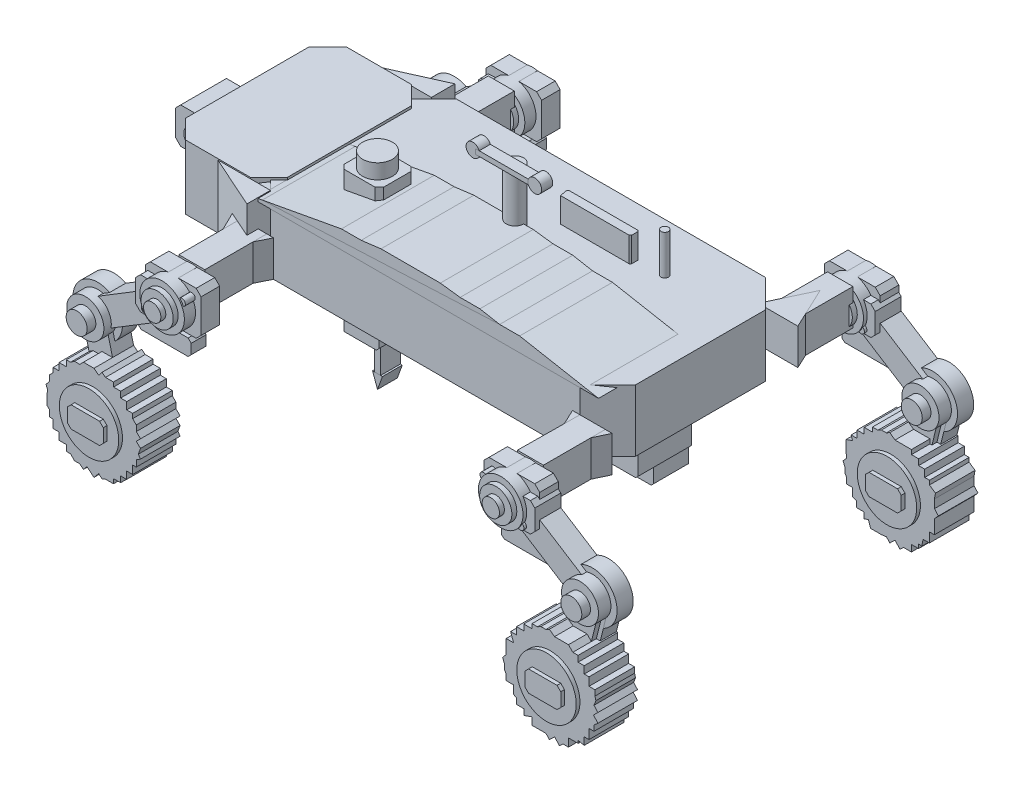
from build123d import *

# Parameters (mm, degrees)
V5_1_THICKER_CHAMFERED_MAIN_CHASSIS_DEPTH      = 100
V5_1_PROJECTING_FRONT_SENSOR_HEAD_DEPTH        = 104
V5_7_FRONT_NEAR_SHOULDER_DIAGONAL_FILL_N_DEPTH = 102
V5_7_FRONT_FAR_SHOULDER_DIAGONAL_FILL_NO_DEPTH = 102
SKETCH_5_W                                     = 42
SKETCH_5_H                                     = 100
V5_17_FRONT_NEAR_SIDE_100MM_OUTBOARD_BEA_DEPTH = 58
SKETCH_6_W                                     = 41
SKETCH_6_H                                     = 100
V5_17_REAR_NEAR_SIDE_100MM_OUTBOARD_BEAM_DEPTH = 58
SKETCH_7_W                                     = 42
SKETCH_7_H                                     = 100
V5_17_FRONT_FAR_SIDE_100MM_OUTBOARD_BEAM_DEPTH = 58
V5_17_REAR_FAR_SIDE_100MM_OUTBOARD_BEAM_DEPTH  = 58
V5_13_FRONT_NEAR_SIDE_COMPACT_ROOT_GUSSE_DEPTH = 58
V5_13_REAR_NEAR_SIDE_COMPACT_ROOT_GUSSET_DEPTH = 58
V5_13_FRONT_FAR_SIDE_COMPACT_ROOT_GUSSET_DEPTH = 58
V5_13_REAR_FAR_SIDE_COMPACT_ROOT_GUSSET_DEPTH  = 58
V5_1_NEAR_SEGMENTED_CURVED_UPPER_SHELL_DEPTH   = 150
V5_1_FAR_SEGMENTED_CURVED_UPPER_SHELL_DEPTH    = 150
V5_1_RECESSED_SIDE_PANEL_FRAME_DEPTH           = 74
V5_1_BATTERY_ELECTRONICS_PANEL_INSERT_DEPTH    = 82
V5_7_INTEGRATED_LOWER_SIDE_SKIRT_NO_LONG_DEPTH = 86
V5_7_PROTECTED_UNDERBODY_PAYLOAD_BAY_JOI_DEPTH = 60
V5_7_FRONT_SKID_VERTICAL_SUPPORT_JOINED_DEPTH  = 56
V5_7_CENTER_SKID_VERTICAL_SUPPORT_JOINED_DEPTH = 56
V5_7_REAR_SKID_VERTICAL_SUPPORT_JOINED_DEPTH   = 56
V5_1_FRONT_STEREO_CAMERA_BEZEL_DEPTH           = 74
SKETCH_23_R                                    = 15
V5_1_LEFT_RGB_CAMERA_LENS_DEPTH                = 84
SKETCH_24_R                                    = 15
V5_1_RIGHT_DEPTH_CAMERA_LENS_DEPTH             = 84
FRONT_NEAR_LEG_SIDE_HIP_MOUNT_PLATE_DEPTH      = 30
FRONT_NEAR_LEG_SIDE_FORK_CLEVIS_BLOCK_DEPTH    = 42
FRONT_NEAR_LEG_SIDE_CHAMFERED_GUSSET_BLO_DEPTH = 24
SKETCH_28_R                                    = 5.5
FRONT_NEAR_LEG_SIDE_UPPER_MOUNT_BOLT_DEPTH     = 46
SKETCH_29_R                                    = 5.5
FRONT_NEAR_LEG_SIDE_LOWER_MOUNT_BOLT_DEPTH     = 46
FRONT_NEAR_LEG_SIDE_UPPER_PARALLEL_LINK_DEPTH  = 34
FRONT_NEAR_LEG_SIDE_INNER_UPPER_LINK_DEPTH     = 26
FRONT_NEAR_LEG_SIDE_LOWER_PARALLEL_LINK_DEPTH  = 34
FRONT_NEAR_LEG_SIDE_INNER_LOWER_LINK_DEPTH     = 26
SKETCH_34_R                                    = 36
FRONT_NEAR_LEG_SIDE_HIP_JOINT_POD_DEPTH        = 48
SKETCH_35_R                                    = 26
FRONT_NEAR_LEG_SIDE_HIP_ANGLE_CONTROL_WA_DEPTH = 56
SKETCH_36_R                                    = 14
FRONT_NEAR_LEG_SIDE_HIP_PIN_CAP_DEPTH          = 64
SKETCH_37_R                                    = 30
FRONT_NEAR_LEG_SIDE_KNEE_JOINT_POD_DEPTH       = 46
SKETCH_38_R                                    = 40
FRONT_NEAR_LEG_SIDE_KNEE_OUTER_ANGLE_PLA_DEPTH = 26
SKETCH_39_R                                    = 17
FRONT_NEAR_LEG_SIDE_KNEE_PIN_CAP_DEPTH         = 60
SKETCH_40_R                                    = 30
FRONT_NEAR_LEG_SIDE_AXLE_JOINT_POD_DEPTH       = 46
SKETCH_41_R                                    = 21
FRONT_NEAR_LEG_SIDE_AXLE_PIN_CAP_DEPTH         = 58
FRONT_NEAR_LEG_SIDE_MOUNTED_BLOCK_TREAD_DEPTH  = 64
SKETCH_43_R                                    = 48
FRONT_NEAR_LEG_SIDE_SILVER_HUB_DISC_DEPTH      = 70
FRONT_NEAR_LEG_SIDE_RECTANGULAR_HUB_CAP_DEPTH  = 76
REAR_NEAR_LEG_SIDE_HIP_MOUNT_PLATE_DEPTH       = 30
REAR_NEAR_LEG_SIDE_FORK_CLEVIS_BLOCK_DEPTH     = 42
REAR_NEAR_LEG_SIDE_CHAMFERED_GUSSET_BLOC_DEPTH = 24
SKETCH_48_R                                    = 5.5
REAR_NEAR_LEG_SIDE_UPPER_MOUNT_BOLT_DEPTH      = 46
SKETCH_49_R                                    = 5.5
REAR_NEAR_LEG_SIDE_LOWER_MOUNT_BOLT_DEPTH      = 46
REAR_NEAR_LEG_SIDE_UPPER_PARALLEL_LINK_DEPTH   = 34
REAR_NEAR_LEG_SIDE_INNER_UPPER_LINK_DEPTH      = 26
REAR_NEAR_LEG_SIDE_LOWER_PARALLEL_LINK_DEPTH   = 34
REAR_NEAR_LEG_SIDE_INNER_LOWER_LINK_DEPTH      = 26
SKETCH_54_R                                    = 36
REAR_NEAR_LEG_SIDE_HIP_JOINT_POD_DEPTH         = 48
SKETCH_55_R                                    = 26
REAR_NEAR_LEG_SIDE_HIP_ANGLE_CONTROL_WAS_DEPTH = 56
SKETCH_56_R                                    = 14
REAR_NEAR_LEG_SIDE_HIP_PIN_CAP_DEPTH           = 64
SKETCH_57_R                                    = 29.877507243
REAR_NEAR_LEG_SIDE_KNEE_JOINT_POD_DEPTH        = 46
SKETCH_58_R                                    = 40
REAR_NEAR_LEG_SIDE_KNEE_OUTER_ANGLE_PLAT_DEPTH = 26
SKETCH_59_R                                    = 17
REAR_NEAR_LEG_SIDE_KNEE_PIN_CAP_DEPTH          = 60
SKETCH_60_R                                    = 30.007079554
REAR_NEAR_LEG_SIDE_AXLE_JOINT_POD_DEPTH        = 46
SKETCH_61_R                                    = 21
REAR_NEAR_LEG_SIDE_AXLE_PIN_CAP_DEPTH          = 58
REAR_NEAR_LEG_SIDE_MOUNTED_BLOCK_TREAD_T_DEPTH = 64
SKETCH_63_R                                    = 48
REAR_NEAR_LEG_SIDE_SILVER_HUB_DISC_DEPTH       = 70
REAR_NEAR_LEG_SIDE_RECTANGULAR_HUB_CAP_DEPTH   = 76
FRONT_FAR_LEG_SIDE_HIP_MOUNT_PLATE_DEPTH       = 30
FRONT_FAR_LEG_SIDE_FORK_CLEVIS_BLOCK_DEPTH     = 42
FRONT_FAR_LEG_SIDE_CHAMFERED_GUSSET_BLOC_DEPTH = 24
SKETCH_68_R                                    = 5.555512755
FRONT_FAR_LEG_SIDE_UPPER_MOUNT_BOLT_DEPTH      = 46
SKETCH_69_R                                    = 5.5
FRONT_FAR_LEG_SIDE_LOWER_MOUNT_BOLT_DEPTH      = 46
FRONT_FAR_LEG_SIDE_UPPER_PARALLEL_LINK_DEPTH   = 34
FRONT_FAR_LEG_SIDE_INNER_UPPER_LINK_DEPTH      = 26
FRONT_FAR_LEG_SIDE_LOWER_PARALLEL_LINK_DEPTH   = 34
FRONT_FAR_LEG_SIDE_INNER_LOWER_LINK_DEPTH      = 26
SKETCH_74_R                                    = 36
FRONT_FAR_LEG_SIDE_HIP_JOINT_POD_DEPTH         = 48
SKETCH_75_R                                    = 26
FRONT_FAR_LEG_SIDE_HIP_ANGLE_CONTROL_WAS_DEPTH = 56
SKETCH_76_R                                    = 14
FRONT_FAR_LEG_SIDE_HIP_PIN_CAP_DEPTH           = 64
SKETCH_77_R                                    = 30
FRONT_FAR_LEG_SIDE_KNEE_JOINT_POD_DEPTH        = 46
SKETCH_78_R                                    = 40
FRONT_FAR_LEG_SIDE_KNEE_OUTER_ANGLE_PLAT_DEPTH = 26
SKETCH_79_R                                    = 17
FRONT_FAR_LEG_SIDE_KNEE_PIN_CAP_DEPTH          = 60
SKETCH_80_R                                    = 30
FRONT_FAR_LEG_SIDE_AXLE_JOINT_POD_DEPTH        = 46
SKETCH_81_R                                    = 21
FRONT_FAR_LEG_SIDE_AXLE_PIN_CAP_DEPTH          = 58
FRONT_FAR_LEG_SIDE_MOUNTED_BLOCK_TREAD_T_DEPTH = 64
SKETCH_83_R                                    = 48
FRONT_FAR_LEG_SIDE_SILVER_HUB_DISC_DEPTH       = 70
FRONT_FAR_LEG_SIDE_RECTANGULAR_HUB_CAP_DEPTH   = 76
REAR_FAR_LEG_SIDE_HIP_MOUNT_PLATE_DEPTH        = 30
REAR_FAR_LEG_SIDE_FORK_CLEVIS_BLOCK_DEPTH      = 42
REAR_FAR_LEG_SIDE_CHAMFERED_GUSSET_BLOCK_DEPTH = 24
SKETCH_88_R                                    = 5.5
REAR_FAR_LEG_SIDE_UPPER_MOUNT_BOLT_DEPTH       = 46
SKETCH_89_R                                    = 5.566740906
REAR_FAR_LEG_SIDE_LOWER_MOUNT_BOLT_DEPTH       = 46
REAR_FAR_LEG_SIDE_UPPER_PARALLEL_LINK_DEPTH    = 34
REAR_FAR_LEG_SIDE_INNER_UPPER_LINK_DEPTH       = 26
REAR_FAR_LEG_SIDE_LOWER_PARALLEL_LINK_DEPTH    = 34
REAR_FAR_LEG_SIDE_INNER_LOWER_LINK_DEPTH       = 26
SKETCH_94_R                                    = 36
REAR_FAR_LEG_SIDE_HIP_JOINT_POD_DEPTH          = 48
SKETCH_95_R                                    = 26
REAR_FAR_LEG_SIDE_HIP_ANGLE_CONTROL_WASH_DEPTH = 56
SKETCH_96_R                                    = 14
REAR_FAR_LEG_SIDE_HIP_PIN_CAP_DEPTH            = 64
SKETCH_97_R                                    = 30
REAR_FAR_LEG_SIDE_KNEE_JOINT_POD_DEPTH         = 46
SKETCH_98_R                                    = 40
REAR_FAR_LEG_SIDE_KNEE_OUTER_ANGLE_PLATE_DEPTH = 26
SKETCH_99_R                                    = 17
REAR_FAR_LEG_SIDE_KNEE_PIN_CAP_DEPTH           = 60
SKETCH_100_R                                   = 30
REAR_FAR_LEG_SIDE_AXLE_JOINT_POD_DEPTH         = 46
SKETCH_101_R                                   = 21
REAR_FAR_LEG_SIDE_AXLE_PIN_CAP_DEPTH           = 58
REAR_FAR_LEG_SIDE_MOUNTED_BLOCK_TREAD_TI_DEPTH = 64
SKETCH_103_R                                   = 48
REAR_FAR_LEG_SIDE_SILVER_HUB_DISC_DEPTH        = 70
REAR_FAR_LEG_SIDE_RECTANGULAR_HUB_CAP_DEPTH    = 76
V5_1_ROOF_LIDAR_RTK_BASE_DEPTH                 = 142
SKETCH_106_R                                   = 24
V5_1_LIDAR_RTK_CYLINDRICAL_PUCK_DEPTH          = 166
SKETCH_107_R                                   = 14
V5_1_TALL_ENVIRONMENT_WEATHER_MAST_DEPTH       = 208
SKETCH_108_W                                   = 92
SKETCH_108_H                                   = 8
V5_1_ANEMOMETER_CROSSBAR_DEPTH                 = 18
SKETCH_109_R                                   = 11
V5_1_LEFT_WIND_CUP_DEPTH                       = 18
SKETCH_110_R                                   = 11
V5_1_RIGHT_WIND_CUP_DEPTH                      = 18
SKETCH_111_R                                   = 6
V5_1_SHORT_TELEMETRY_ANTENNA_DEPTH             = 164
V5_1_SILVER_TOP_SERVICE_HANDLE_BAR_DEPTH       = 140
V5_7_SOIL_PROBE_MOUNTING_COLLAR_JOINED_T_DEPTH = 60
SKETCH_114_W                                   = 10
SKETCH_114_H                                   = 92
V5_1_DOWNWARD_SOIL_MOISTURE_PROBE_ROD_DEPTH    = 32
V5_1_SOIL_PROBE_TAPERED_TIP_DEPTH              = 32


with BuildPart() as part:
    # 草图1 → v5_1_thicker_chamfered_main_chassis (new body)
    with BuildSketch(Plane(origin=(0, 0, 0), x_dir=(1, 0, 0), z_dir=(0, 1, 0))):
        Polygon((-225, -150), (275, -150), (320, -105), (320, 105), (275, 150), (-225, 150), (-270, 105), (-270, -105), align=None)
    extrude(amount=V5_1_THICKER_CHAMFERED_MAIN_CHASSIS_DEPTH)

    # 草图17 → v5_7_integrated_lower_side_skirt_no_long_gap (add)
    with BuildSketch(Plane.XY):
        Polygon((-191, -49), (301, -49), (305, -45), (305, 9), (301, 13), (-191, 13), (-195, 9), (-195, -45), align=None)
    extrude(amount=V5_7_INTEGRATED_LOWER_SIDE_SKIRT_NO_LONG_DEPTH)

    # 草图18 → v5_7_protected_underbody_payload_bay_joined (add)
    with BuildSketch(Plane.XY):
        Polygon((-135, -76), (15, -76), (20, -71), (20, -37), (15, -32), (-135, -32), (-140, -37), (-140, -71), align=None)
    extrude(amount=V5_7_PROTECTED_UNDERBODY_PAYLOAD_BAY_JOI_DEPTH)

    # 草图19 → v5_7_front_skid_vertical_support_joined (add)
    with BuildSketch(Plane.XY):
        Polygon((-181, -77), (-159, -77), (-155, -73), (-155, -15), (-159, -11), (-181, -11), (-185, -15), (-185, -73), align=None)
    extrude(amount=V5_7_FRONT_SKID_VERTICAL_SUPPORT_JOINED_DEPTH)

    # 草图20 → v5_7_center_skid_vertical_support_joined (add)
    with BuildSketch(Plane.XY):
        Polygon((29, -77), (51, -77), (55, -73), (55, -15), (51, -11), (29, -11), (25, -15), (25, -73), align=None)
    extrude(amount=V5_7_CENTER_SKID_VERTICAL_SUPPORT_JOINED_DEPTH)

    # 草图21 → v5_7_rear_skid_vertical_support_joined (add)
    with BuildSketch(Plane.XY):
        Polygon((274, -77), (296, -77), (300, -73), (300, -15), (296, -11), (274, -11), (270, -15), (270, -73), align=None)
    extrude(amount=V5_7_REAR_SKID_VERTICAL_SUPPORT_JOINED_DEPTH)

    # 草图113 → v5_7_soil_probe_mounting_collar_joined_to_underbody (add)
    with BuildSketch(Plane.XY):
        Polygon((-196, -106), (-144, -106), (-140, -102), (-140, -46), (-144, -42), (-195, -42), (-196, -42), align=None)
    extrude(amount=V5_7_SOIL_PROBE_MOUNTING_COLLAR_JOINED_T_DEPTH)


with BuildPart() as body_2:
    # 草图2 → v5_1_projecting_front_sensor_head (new body)
    with BuildSketch(Plane(origin=(0, 0, 0), x_dir=(1, 0, 0), z_dir=(0, 1, 0))):
        Polygon((-382.5, -130), (-277.5, -130), (-247.5, -100), (-247.5, 100), (-277.5, 130), (-382.5, 130), (-412.5, 100), (-412.5, -100), align=None)
    extrude(amount=V5_1_PROJECTING_FRONT_SENSOR_HEAD_DEPTH)


with BuildPart() as body_3:
    # 草图3 → v5_7_front_near_shoulder_diagonal_fill_no_gap (new body)
    with BuildSketch(Plane(origin=(0, 0, 0), x_dir=(1, 0, 0), z_dir=(0, 1, 0))):
        Polygon((-330, 130), (-245, 130), (-245, 168), align=None)
    extrude(amount=V5_7_FRONT_NEAR_SHOULDER_DIAGONAL_FILL_N_DEPTH)


with BuildPart() as body_4:
    # 草图4 → v5_7_front_far_shoulder_diagonal_fill_no_gap (new body)
    with BuildSketch(Plane(origin=(0, 0, 0), x_dir=(1, 0, 0), z_dir=(0, 1, 0))):
        Polygon((-330, -130), (-245, -130), (-245, -168), align=None)
    extrude(amount=V5_7_FRONT_FAR_SHOULDER_DIAGONAL_FILL_NO_DEPTH)


with BuildPart() as body_5:
    # 草图5 → v5_17_front_near_side_100mm_outboard_beam_connected (new body)
    with BuildSketch(Plane(origin=(0, 0, 0), x_dir=(1, 0, 0), z_dir=(0, 1, 0))):
        with Locations((-252, 200)):
            Rectangle(SKETCH_5_W, SKETCH_5_H)
    extrude(amount=V5_17_FRONT_NEAR_SIDE_100MM_OUTBOARD_BEA_DEPTH)


with BuildPart() as body_6:
    # 草图6 → v5_17_rear_near_side_100mm_outboard_beam_connected (new body)
    with BuildSketch(Plane(origin=(0, 0, 0), x_dir=(1, 0, 0), z_dir=(0, 1, 0))):
        with Locations((295.5, 200)):
            Rectangle(SKETCH_6_W, SKETCH_6_H)
    extrude(amount=V5_17_REAR_NEAR_SIDE_100MM_OUTBOARD_BEAM_DEPTH)


with BuildPart() as body_7:
    # 草图7 → v5_17_front_far_side_100mm_outboard_beam_connected (new body)
    with BuildSketch(Plane(origin=(0, 0, 0), x_dir=(1, 0, 0), z_dir=(0, 1, 0))):
        with Locations((-252, -200)):
            Rectangle(SKETCH_7_W, SKETCH_7_H)
    extrude(amount=V5_17_FRONT_FAR_SIDE_100MM_OUTBOARD_BEAM_DEPTH)


with BuildPart() as body_8:
    # 草图8 → v5_17_rear_far_side_100mm_outboard_beam_connected (new body)
    with BuildSketch(Plane(origin=(0, 0, 0), x_dir=(1, 0, 0), z_dir=(0, 1, 0))):
        Polygon((274, -250), (316, -250), (316, -150), (275, -150), align=None)
    extrude(amount=V5_17_REAR_FAR_SIDE_100MM_OUTBOARD_BEAM_DEPTH)


with BuildPart() as body_9:
    # 草图9 → v5_13_front_near_side_compact_root_gusset (new body)
    with BuildSketch(Plane(origin=(0, 0, 0), x_dir=(1, 0, 0), z_dir=(0, 1, 0))):
        Polygon((-287.5, 149), (-220, 150), (-253.75, 218), align=None)
    extrude(amount=V5_13_FRONT_NEAR_SIDE_COMPACT_ROOT_GUSSE_DEPTH)


with BuildPart() as body_10:
    # 草图10 → v5_13_rear_near_side_compact_root_gusset (new body)
    with BuildSketch(Plane(origin=(0, 0, 0), x_dir=(1, 0, 0), z_dir=(0, 1, 0))):
        Polygon((263, 150), (327, 150), (295, 218), align=None)
    extrude(amount=V5_13_REAR_NEAR_SIDE_COMPACT_ROOT_GUSSET_DEPTH)


with BuildPart() as body_11:
    # 草图11 → v5_13_front_far_side_compact_root_gusset (new body)
    with BuildSketch(Plane(origin=(0, 0, 0), x_dir=(1, 0, 0), z_dir=(0, 1, 0))):
        Polygon((-287.5, -149), (-220, -150), (-253.75, -218), align=None)
    extrude(amount=V5_13_FRONT_FAR_SIDE_COMPACT_ROOT_GUSSET_DEPTH)


with BuildPart() as body_12:
    # 草图12 → v5_13_rear_far_side_compact_root_gusset (new body)
    with BuildSketch(Plane(origin=(0, 0, 0), x_dir=(1, 0, 0), z_dir=(0, 1, 0))):
        Polygon((263, -150), (327, -150), (295, -218), align=None)
    extrude(amount=V5_13_REAR_FAR_SIDE_COMPACT_ROOT_GUSSET_DEPTH)


with BuildPart() as body_13:
    # 草图13 → v5_1_near_segmented_curved_upper_shell (new body)
    with BuildSketch(Plane.XY):
        Polygon((-270, 96), (305, 96), (273.055555556, 101.904038041), (241.14317141, 107.802150631), (209.293933726, 113.688592362), (177.537009993, 119.557972438), (145.277777778, 119.557972438), (113.333333333, 125.444863729), (81.388888889, 125.444863729), (49.444444444, 129.483463602), (17.5, 129.483463602), (-14.444444444, 129.483463602), (-46.388888889, 129.483463602), (-78.333333333, 125.444863729), (-110.277777778, 125.444863729), (-142.222222222, 119.557972438), (-174.071644358, 113.688592362), (-206.013649328, 107.802150631), (-238.018984687, 101.904038041), align=None)
    extrude(amount=V5_1_NEAR_SEGMENTED_CURVED_UPPER_SHELL_DEPTH)


with BuildPart() as body_14:
    # 草图14 → v5_1_far_segmented_curved_upper_shell (new body)
    with BuildSketch(Plane.XY):
        Polygon((-270, 96), (305, 96), (273.055555556, 101.904038041), (241.268504996, 107.778986219), (209.293933726, 113.688592362), (177.537009993, 119.557972438), (145.277777778, 119.557972438), (113.333333333, 125.444863729), (81.388888889, 125.444863729), (49.444444444, 129.483463602), (17.5, 129.483463602), (-14.444444444, 129.483463602), (-46.388888889, 129.483463602), (-78.333333333, 125.444863729), (-110.277777778, 125.444863729), (-142.222222222, 119.557972438), (-174.148381232, 113.674450885), (-206.139347974, 107.778986219), (-238.018984687, 101.904038041), align=None)
    extrude(amount=V5_1_FAR_SEGMENTED_CURVED_UPPER_SHELL_DEPTH)


with BuildPart() as body_15:
    # 草图15 → v5_1_recessed_side_panel_frame (new body)
    with BuildSketch(Plane.XY):
        Polygon((10.5, 14), (199.5, 14), (207.5, 22), (207.5, 82), (199.5, 90), (10.5, 90), (0, 79.5), (0, 22), align=None)
    extrude(amount=V5_1_RECESSED_SIDE_PANEL_FRAME_DEPTH)


with BuildPart() as body_16:
    # 草图16 → v5_1_battery_electronics_panel_insert (new body)
    with BuildSketch(Plane.XY):
        Polygon((31, 28), (179, 28), (184, 33), (184, 75), (179, 80), (31, 80), (26, 75), (26, 33), align=None)
    extrude(amount=V5_1_BATTERY_ELECTRONICS_PANEL_INSERT_DEPTH)


with BuildPart() as body_17:
    # 草图22 → v5_1_front_stereo_camera_bezel (new body)
    with BuildSketch(Plane.XY):
        Polygon((-446, 35), (-338, 35), (-330, 43), (-330, 85), (-338, 93), (-446, 93), (-454, 85), (-454, 43), align=None)
    extrude(amount=V5_1_FRONT_STEREO_CAMERA_BEZEL_DEPTH)


with BuildPart() as body_18:
    # 草图23 → v5_1_left_rgb_camera_lens (new body)
    with BuildSketch(Plane.XY):
        with Locations(Location((-416, 66, 0), (0, 0, 180))):
            Circle(SKETCH_23_R)
    extrude(amount=V5_1_LEFT_RGB_CAMERA_LENS_DEPTH)


with BuildPart() as body_19:
    # 草图24 → v5_1_right_depth_camera_lens (new body)
    with BuildSketch(Plane.XY):
        with Locations(Location((-370, 66, 0), (0, 0, 180))):
            Circle(SKETCH_24_R)
    extrude(amount=V5_1_RIGHT_DEPTH_CAMERA_LENS_DEPTH)


with BuildPart() as body_20:
    # 草图25 → front_near_leg_side_hip_mount_plate (new body)
    with BuildSketch(Plane.XY.offset(250)):
        Polygon((-289, -15), (-215, -15), (-207, -7), (-207, 47), (-215, 55), (-289, 55), (-297, 47), (-297, -7), align=None)
    extrude(amount=FRONT_NEAR_LEG_SIDE_HIP_MOUNT_PLATE_DEPTH)


with BuildPart() as body_21:
    # 草图26 → front_near_leg_side_fork_clevis_block (new body)
    with BuildSketch(Plane.XY.offset(250)):
        Polygon((-293, -11), (-246, -11), (-238, -3), (-238, 33), (-246, 41), (-293, 41), (-301, 33), (-301, -3), align=None)
    extrude(amount=FRONT_NEAR_LEG_SIDE_FORK_CLEVIS_BLOCK_DEPTH)


with BuildPart() as body_22:
    # 草图27 → front_near_leg_side_chamfered_gusset_block (new body)
    with BuildSketch(Plane.XY.offset(250)):
        Polygon((-310, -53), (-234, -53), (-229, -48), (-229, -32), (-234, -27), (-310, -27), (-315, -32), (-315, -48), align=None)
    extrude(amount=FRONT_NEAR_LEG_SIDE_CHAMFERED_GUSSET_BLO_DEPTH)


with BuildPart() as body_23:
    # 草图28 → front_near_leg_side_upper_mount_bolt (new body)
    with BuildSketch(Plane.XY.offset(250)):
        with Locations((-222, 40)):
            Circle(SKETCH_28_R)
    extrude(amount=FRONT_NEAR_LEG_SIDE_UPPER_MOUNT_BOLT_DEPTH)


with BuildPart() as body_24:
    # 草图29 → front_near_leg_side_lower_mount_bolt (new body)
    with BuildSketch(Plane.XY.offset(250)):
        with Locations((-282, 0)):
            Circle(SKETCH_29_R)
    extrude(amount=FRONT_NEAR_LEG_SIDE_LOWER_MOUNT_BOLT_DEPTH)


with BuildPart() as body_25:
    # 草图30 → front_near_leg_side_upper_parallel_link (new body)
    with BuildSketch(Plane.XY.offset(250)):
        Polygon((-241.279837267, 0), (-367.279837267, -76.884256305), (-388.111687363, -42.744456581), (-261.334784086, 34.613860284), align=None)
    extrude(amount=FRONT_NEAR_LEG_SIDE_UPPER_PARALLEL_LINK_DEPTH)


with BuildPart() as body_26:
    # 草图31 → front_near_leg_side_inner_upper_link (new body)
    with BuildSketch(Plane.XY.offset(250)):
        Polygon((-262.17592677, 0), (-388.17592677, -77.597915337), (-397.614039026, -62.272733739), (-270.751527953, 15.856364623), align=None)
    extrude(amount=FRONT_NEAR_LEG_SIDE_INNER_UPPER_LINK_DEPTH)


with BuildPart() as body_27:
    # 草图32 → front_near_leg_side_lower_parallel_link (new body)
    with BuildSketch(Plane.XY.offset(250)):
        Polygon((-358.597149997, -55.149287499), (-328.597149997, -175.149287499), (-367.402850003, -184.850712501), (-396.404882451, -64.236107726), align=None)
    extrude(amount=FRONT_NEAR_LEG_SIDE_LOWER_PARALLEL_LINK_DEPTH)


with BuildPart() as body_28:
    # 草图33 → front_near_leg_side_inner_lower_link (new body)
    with BuildSketch(Plane.XY.offset(250)):
        Polygon((-384.268717499, -67.817179375), (-354.268717499, -187.817179375), (-369.268717499, -191.567179375), (-399.268717499, -71.567179375), align=None)
    extrude(amount=FRONT_NEAR_LEG_SIDE_INNER_LOWER_LINK_DEPTH)


with BuildPart() as body_29:
    # 草图34 → front_near_leg_side_hip_joint_pod (new body)
    with BuildSketch(Plane.XY.offset(250)):
        with Locations((-252, 20)):
            Circle(SKETCH_34_R)
    extrude(amount=FRONT_NEAR_LEG_SIDE_HIP_JOINT_POD_DEPTH)


with BuildPart() as body_30:
    # 草图35 → front_near_leg_side_hip_angle_control_washer (new body)
    with BuildSketch(Plane.XY.offset(250)):
        with Locations((-252, 20)):
            Circle(SKETCH_35_R)
    extrude(amount=FRONT_NEAR_LEG_SIDE_HIP_ANGLE_CONTROL_WA_DEPTH)


with BuildPart() as body_31:
    # 草图36 → front_near_leg_side_hip_pin_cap (new body)
    with BuildSketch(Plane.XY.offset(250)):
        with Locations((-252, 20)):
            Circle(SKETCH_36_R)
    extrude(amount=FRONT_NEAR_LEG_SIDE_HIP_PIN_CAP_DEPTH)


with BuildPart() as body_32:
    # 草图37 → front_near_leg_side_knee_joint_pod (new body)
    with BuildSketch(Plane.XY.offset(250)):
        with Locations((-378, -60)):
            Circle(SKETCH_37_R)
    extrude(amount=FRONT_NEAR_LEG_SIDE_KNEE_JOINT_POD_DEPTH)


with BuildPart() as body_33:
    # 草图38 → front_near_leg_side_knee_outer_angle_plate (new body)
    with BuildSketch(Plane.XY.offset(250)):
        with Locations(Location((-378, -60, 0), (0, 0, 180))):
            Circle(SKETCH_38_R)
    extrude(amount=FRONT_NEAR_LEG_SIDE_KNEE_OUTER_ANGLE_PLA_DEPTH)


with BuildPart() as body_34:
    # 草图39 → front_near_leg_side_knee_pin_cap (new body)
    with BuildSketch(Plane.XY.offset(250)):
        with Locations((-378, -60)):
            Circle(SKETCH_39_R)
    extrude(amount=FRONT_NEAR_LEG_SIDE_KNEE_PIN_CAP_DEPTH)


with BuildPart() as body_35:
    # 草图40 → front_near_leg_side_axle_joint_pod (new body)
    with BuildSketch(Plane.XY.offset(250)):
        with Locations((-348, -180)):
            Circle(SKETCH_40_R)
    extrude(amount=FRONT_NEAR_LEG_SIDE_AXLE_JOINT_POD_DEPTH)


with BuildPart() as body_36:
    # 草图41 → front_near_leg_side_axle_pin_cap (new body)
    with BuildSketch(Plane.XY.offset(250)):
        with Locations(Location((-348, -180, 0), (0, 0, 180))):
            Circle(SKETCH_41_R)
    extrude(amount=FRONT_NEAR_LEG_SIDE_AXLE_PIN_CAP_DEPTH)


with BuildPart() as body_37:
    # 草图42 → front_near_leg_side_mounted_block_tread_tire (new body)
    with BuildSketch(Plane.XY.offset(250)):
        Polygon((-271, -180), (-277.650550685, -173.349449315), (-270.879339992, -166.578238622), (-277.650550685, -159.807027929), (-277.650550685, -150.533375708), (-283.518342469, -144.665583923), (-283.518342469, -137.221092057), (-293.116257811, -137.221092057), (-293.116257811, -125.552777849), (-302.958076824, -125.552777849), (-302.958076824, -115.976839853), (-314.530831685, -115.976839853), (-314.530831685, -108.861275997), (-327.389787915, -108.861275997), (-332.978045205, -104.479533409), (-338.408784826, -111.405629515), (-346.026280737, -105.432764539), (-354.959216963, -105.432764539), (-363.021954795, -105.432764539), (-368.994819772, -111.405629515), (-377.466624292, -111.405629515), (-383.963715854, -115.976839853), (-390.778907943, -115.976839853), (-390.778907943, -125.552777849), (-402.447222151, -125.552777849), (-402.447222151, -137.221092057), (-412.023160147, -137.221092057), (-412.023160147, -144.665583923), (-417.890951932, -150.533375708), (-417.890951932, -159.807027929), (-423.520466591, -166.578238622), (-420.705709261, -173.349449315), (-422.113087926, -180), (-422.113087926, -186.959216963), (-422.113087926, -195.021954795), (-417.890951932, -199.24409079), (-417.890951932, -209.466624292), (-412.023160147, -209.466624292), (-412.023160147, -222.778907943), (-402.447222151, -222.778907943), (-402.447222151, -234.447222151), (-390.778907943, -234.447222151), (-390.778907943, -244.023160147), (-383.963715854, -244.023160147), (-377.466624292, -250.520251709), (-368.994819772, -250.520251709), (-363.021954795, -255.520466591), (-357.306422913, -248.693139964), (-346.026280737, -258.136369469), (-338.408784826, -249.037105615), (-332.978045205, -253.583477445), (-327.389787915, -251.31029153), (-314.530831685, -251.31029153), (-314.530831685, -244.023160147), (-302.958076824, -244.023160147), (-302.958076824, -234.447222151), (-293.116257811, -234.447222151), (-293.116257811, -222.778907943), (-283.518342469, -222.778907943), (-283.518342469, -209.466624292), (-277.650550685, -209.466624292), (-277.650550685, -199.24409079), (-271, -195.021954795), (-274.325275342, -189.784105461), align=None)
    extrude(amount=FRONT_NEAR_LEG_SIDE_MOUNTED_BLOCK_TREAD_DEPTH)


with BuildPart() as body_38:
    # 草图43 → front_near_leg_side_silver_hub_disc (new body)
    with BuildSketch(Plane.XY.offset(250)):
        with Locations((-348, -180)):
            Circle(SKETCH_43_R)
    extrude(amount=FRONT_NEAR_LEG_SIDE_SILVER_HUB_DISC_DEPTH)


with BuildPart() as body_39:
    # 草图44 → front_near_leg_side_rectangular_hub_cap (new body)
    with BuildSketch(Plane.XY.offset(250)):
        Polygon((-371, -197), (-325, -197), (-319, -191), (-319, -169), (-325, -163), (-371, -163), (-377, -169), (-377, -191), align=None)
    extrude(amount=FRONT_NEAR_LEG_SIDE_RECTANGULAR_HUB_CAP_DEPTH)


with BuildPart() as body_40:
    # 草图45 → rear_near_leg_side_hip_mount_plate (new body)
    with BuildSketch(Plane.XY.offset(250)):
        Polygon((258, -15), (332, -15), (340, -7), (340, 47), (332, 55), (258, 55), (250, 47), (250, -7), align=None)
    extrude(amount=REAR_NEAR_LEG_SIDE_HIP_MOUNT_PLATE_DEPTH)


with BuildPart() as body_41:
    # 草图46 → rear_near_leg_side_fork_clevis_block (new body)
    with BuildSketch(Plane.XY.offset(250)):
        Polygon((289, -7), (337, -7), (344, 0), (344, 33), (337, 40), (289, 40), (282, 33), (282, 0), align=None)
    extrude(amount=REAR_NEAR_LEG_SIDE_FORK_CLEVIS_BLOCK_DEPTH)


with BuildPart() as body_42:
    # 草图47 → rear_near_leg_side_chamfered_gusset_block (new body)
    with BuildSketch(Plane.XY.offset(250)):
        Polygon((277, -53), (353, -53), (358, -48), (358, -32), (353, -27), (277, -27), (272, -32), (272, -49), align=None)
    extrude(amount=REAR_NEAR_LEG_SIDE_CHAMFERED_GUSSET_BLOC_DEPTH)


with BuildPart() as body_43:
    # 草图48 → rear_near_leg_side_upper_mount_bolt (new body)
    with BuildSketch(Plane.XY.offset(250)):
        with Locations((265, 40)):
            Circle(SKETCH_48_R)
    extrude(amount=REAR_NEAR_LEG_SIDE_UPPER_MOUNT_BOLT_DEPTH)


with BuildPart() as body_44:
    # 草图49 → rear_near_leg_side_lower_mount_bolt (new body)
    with BuildSketch(Plane.XY.offset(250)):
        with Locations((325, 0)):
            Circle(SKETCH_49_R)
    extrude(amount=REAR_NEAR_LEG_SIDE_LOWER_MOUNT_BOLT_DEPTH)


with BuildPart() as body_45:
    # 草图50 → rear_near_leg_side_upper_parallel_link (new body)
    with BuildSketch(Plane.XY.offset(250)):
        Polygon((305.720162733, 36.884256305), (431.720162733, -43.115743695), (410.279837267, -76.884256305), (282, 4.56325942), align=None)
    extrude(amount=REAR_NEAR_LEG_SIDE_UPPER_PARALLEL_LINK_DEPTH)


with BuildPart() as body_46:
    # 草图51 → rear_near_leg_side_inner_upper_link (new body)
    with BuildSketch(Plane.XY.offset(250)):
        Polygon((314.82407323, 17.597915337), (440.82407323, -62.402084663), (431.17592677, -77.597915337), (308.959210114, 0), align=None)
    extrude(amount=REAR_NEAR_LEG_SIDE_INNER_UPPER_LINK_DEPTH)


with BuildPart() as body_47:
    # 草图52 → rear_near_leg_side_lower_parallel_link (new body)
    with BuildSketch(Plane.XY.offset(250)):
        Polygon((440.82407323, -62.402084663), (410.402850003, -184.850712501), (371.58299089, -175.206279398), (401.420912284, -55.105502878), align=None)
    extrude(amount=REAR_NEAR_LEG_SIDE_LOWER_PARALLEL_LINK_DEPTH)


with BuildPart() as body_48:
    # 草图53 → rear_near_leg_side_inner_lower_link (new body)
    with BuildSketch(Plane.XY.offset(250)):
        Polygon((444.731282501, -72.182820625), (414.731282501, -192.182820625), (397.268717499, -192.182820625), (427.268717499, -72.182820625), align=None)
    extrude(amount=REAR_NEAR_LEG_SIDE_INNER_LOWER_LINK_DEPTH)


with BuildPart() as body_49:
    # 草图54 → rear_near_leg_side_hip_joint_pod (new body)
    with BuildSketch(Plane.XY.offset(250)):
        with Locations((295, 20)):
            Circle(SKETCH_54_R)
    extrude(amount=REAR_NEAR_LEG_SIDE_HIP_JOINT_POD_DEPTH)


with BuildPart() as body_50:
    # 草图55 → rear_near_leg_side_hip_angle_control_washer (new body)
    with BuildSketch(Plane.XY.offset(250)):
        with Locations((295, 20)):
            Circle(SKETCH_55_R)
    extrude(amount=REAR_NEAR_LEG_SIDE_HIP_ANGLE_CONTROL_WAS_DEPTH)


with BuildPart() as body_51:
    # 草图56 → rear_near_leg_side_hip_pin_cap (new body)
    with BuildSketch(Plane.XY.offset(250)):
        with Locations((295, 20)):
            Circle(SKETCH_56_R)
    extrude(amount=REAR_NEAR_LEG_SIDE_HIP_PIN_CAP_DEPTH)


with BuildPart() as body_52:
    # 草图57 → rear_near_leg_side_knee_joint_pod (new body)
    with BuildSketch(Plane.XY.offset(250)):
        with Locations((421.122492757, -58.75379377)):
            Circle(SKETCH_57_R)
    extrude(amount=REAR_NEAR_LEG_SIDE_KNEE_JOINT_POD_DEPTH)


with BuildPart() as body_53:
    # 草图58 → rear_near_leg_side_knee_outer_angle_plate (new body)
    with BuildSketch(Plane.XY.offset(250)):
        with Locations(Location((421, -60, 0), (0, 0, 180))):
            Circle(SKETCH_58_R)
    extrude(amount=REAR_NEAR_LEG_SIDE_KNEE_OUTER_ANGLE_PLAT_DEPTH)


with BuildPart() as body_54:
    # 草图59 → rear_near_leg_side_knee_pin_cap (new body)
    with BuildSketch(Plane.XY.offset(250)):
        with Locations((421, -60)):
            Circle(SKETCH_59_R)
    extrude(amount=REAR_NEAR_LEG_SIDE_KNEE_PIN_CAP_DEPTH)


with BuildPart() as body_55:
    # 草图60 → rear_near_leg_side_axle_joint_pod (new body)
    with BuildSketch(Plane.XY.offset(250)):
        with Locations((390.992920446, -180.028495949)):
            Circle(SKETCH_60_R)
    extrude(amount=REAR_NEAR_LEG_SIDE_AXLE_JOINT_POD_DEPTH)


with BuildPart() as body_56:
    # 草图61 → rear_near_leg_side_axle_pin_cap (new body)
    with BuildSketch(Plane.XY.offset(250)):
        with Locations(Location((391, -180, 0), (0, 0, 180))):
            Circle(SKETCH_61_R)
    extrude(amount=REAR_NEAR_LEG_SIDE_AXLE_PIN_CAP_DEPTH)


with BuildPart() as body_57:
    # 草图62 → rear_near_leg_side_mounted_block_tread_tire (new body)
    with BuildSketch(Plane.XY.offset(250)):
        Polygon((468, -180), (461.658115594, -173.040783037), (464.829057797, -164.978045205), (463.243586695, -159.389787915), (463.243586695, -150.533375708), (453.616409769, -150.533375708), (453.616409769, -137.221092057), (445.883742189, -137.221092057), (445.883742189, -125.552777849), (436.041923176, -125.552777849), (436.041923176, -115.976839853), (427.513923368, -115.976839853), (420.432491902, -108.895408387), (411.610212085, -108.895408387), (406.021954795, -108.895408387), (397.959216963, -108.895408387), (389.607894365, -102.654144297), (384.040783037, -105.774776342), (375.978045205, -105.774776342), (370.389787915, -108.895408387), (361.533375708, -108.895408387), (361.533375708, -115.976839853), (348.221092057, -115.976839853), (348.221092057, -125.552777849), (336.552777849, -125.552777849), (336.552777849, -137.221092057), (326.976839853, -137.221092057), (331.764808851, -150.533375708), (319.861275997, -150.533375708), (319.861275997, -159.389787915), (319.861275997, -164.978045205), (319.861275997, -173.040783037), (314, -180), (316.930637998, -186.959216963), (316.930637998, -195.021954795), (319.861275997, -200.610212085), (319.861275997, -209.466624292), (331.764808851, -209.466624292), (331.764808851, -222.778907943), (336.116257811, -225.041923176), (336.116257811, -234.447222151), (348.221092057, -234.447222151), (348.221092057, -244.023160147), (361.533375708, -239.235191149), (361.533375708, -251.138724003), (370.389787915, -251.138724003), (375.978045205, -251.138724003), (384.040783037, -251.138724003), (389.607894365, -257), (397.959216963, -249.067812082), (406.021954795, -257.556582816), (411.610212085, -252.24878798), (420.432491902, -252.24878798), (420.432491902, -239.235191149), (436.041923176, -239.235191149), (436.041923176, -234.883742189), (445.883742189, -237.059466669), (445.883742189, -225.041923176), (453.616409769, -225.041923176), (453.616409769, -209.466624292), (461.658115594, -209.466624292), (461.658115594, -200.610212085), (468, -195.021954795), (460.895383993, -186.959216963), align=None)
    extrude(amount=REAR_NEAR_LEG_SIDE_MOUNTED_BLOCK_TREAD_T_DEPTH)


with BuildPart() as body_58:
    # 草图63 → rear_near_leg_side_silver_hub_disc (new body)
    with BuildSketch(Plane.XY.offset(250)):
        with Locations((391, -180)):
            Circle(SKETCH_63_R)
    extrude(amount=REAR_NEAR_LEG_SIDE_SILVER_HUB_DISC_DEPTH)


with BuildPart() as body_59:
    # 草图64 → rear_near_leg_side_rectangular_hub_cap (new body)
    with BuildSketch(Plane.XY.offset(250)):
        Polygon((368, -197), (414, -197), (420, -191), (420, -169), (414, -163), (368, -163), (362, -169), (362, -191), align=None)
    extrude(amount=REAR_NEAR_LEG_SIDE_RECTANGULAR_HUB_CAP_DEPTH)


with BuildPart() as body_60:
    # 草图65 → front_far_leg_side_hip_mount_plate (new body)
    with BuildSketch(Plane.XY):
        Polygon((-289, -15), (-215, -15), (-207, -7), (-207, 47), (-215, 55), (-289, 55), (-297, 47), (-297, -7), align=None)
    extrude(amount=FRONT_FAR_LEG_SIDE_HIP_MOUNT_PLATE_DEPTH)


with BuildPart() as body_61:
    # 草图66 → front_far_leg_side_fork_clevis_block (new body)
    with BuildSketch(Plane.XY):
        Polygon((-297, -7), (-246, -7), (-235.386752274, 0), (-235.386752274, 33), (-246, 43.613247726), (-293, 41), (-297, 36.529004022), (-301, -3), align=None)
    extrude(amount=FRONT_FAR_LEG_SIDE_FORK_CLEVIS_BLOCK_DEPTH)


with BuildPart() as body_62:
    # 草图67 → front_far_leg_side_chamfered_gusset_block (new body)
    with BuildSketch(Plane.XY):
        Polygon((-310, -53), (-234, -53), (-229, -48), (-229, -32), (-234, -27), (-310, -27), (-315, -32), (-315, -48), align=None)
    extrude(amount=FRONT_FAR_LEG_SIDE_CHAMFERED_GUSSET_BLOC_DEPTH)


with BuildPart() as body_63:
    # 草图68 → front_far_leg_side_upper_mount_bolt (new body)
    with BuildSketch(Plane.XY):
        with Locations((-222.046189404, 39.969207064)):
            Circle(SKETCH_68_R)
    extrude(amount=FRONT_FAR_LEG_SIDE_UPPER_MOUNT_BOLT_DEPTH)


with BuildPart() as body_64:
    # 草图69 → front_far_leg_side_lower_mount_bolt (new body)
    with BuildSketch(Plane.XY):
        with Locations((-282, 0)):
            Circle(SKETCH_69_R)
    extrude(amount=FRONT_FAR_LEG_SIDE_LOWER_MOUNT_BOLT_DEPTH)


with BuildPart() as body_65:
    # 草图70 → front_far_leg_side_upper_parallel_link (new body)
    with BuildSketch(Plane.XY):
        Polygon((-241.279837267, 0), (-367.279837267, -76.884256305), (-388.111687363, -42.744456581), (-261.334784086, 34.613860284), align=None)
    extrude(amount=FRONT_FAR_LEG_SIDE_UPPER_PARALLEL_LINK_DEPTH)


with BuildPart() as body_66:
    # 草图71 → front_far_leg_side_inner_upper_link (new body)
    with BuildSketch(Plane.XY):
        Polygon((-262.17592677, 0), (-388.17592677, -77.597915337), (-397.614039026, -62.272733739), (-270.751527953, 15.856364623), align=None)
    extrude(amount=FRONT_FAR_LEG_SIDE_INNER_UPPER_LINK_DEPTH)


with BuildPart() as body_67:
    # 草图72 → front_far_leg_side_lower_parallel_link (new body)
    with BuildSketch(Plane.XY):
        Polygon((-358.597149997, -55.149287499), (-328.597149997, -175.149287499), (-367.402850003, -184.850712501), (-397.402850003, -64.850712501), align=None)
    extrude(amount=FRONT_FAR_LEG_SIDE_LOWER_PARALLEL_LINK_DEPTH)


with BuildPart() as body_68:
    # 草图73 → front_far_leg_side_inner_lower_link (new body)
    with BuildSketch(Plane.XY):
        Polygon((-384.268717499, -67.817179375), (-354.268717499, -187.817179375), (-369.268717499, -187.817179375), (-404.688616083, -73.701013523), align=None)
    extrude(amount=FRONT_FAR_LEG_SIDE_INNER_LOWER_LINK_DEPTH)


with BuildPart() as body_69:
    # 草图74 → front_far_leg_side_hip_joint_pod (new body)
    with BuildSketch(Plane.XY):
        with Locations((-252, 20)):
            Circle(SKETCH_74_R)
    extrude(amount=FRONT_FAR_LEG_SIDE_HIP_JOINT_POD_DEPTH)


with BuildPart() as body_70:
    # 草图75 → front_far_leg_side_hip_angle_control_washer (new body)
    with BuildSketch(Plane.XY):
        with Locations((-252, 20)):
            Circle(SKETCH_75_R)
    extrude(amount=FRONT_FAR_LEG_SIDE_HIP_ANGLE_CONTROL_WAS_DEPTH)


with BuildPart() as body_71:
    # 草图76 → front_far_leg_side_hip_pin_cap (new body)
    with BuildSketch(Plane.XY):
        with Locations((-252, 20)):
            Circle(SKETCH_76_R)
    extrude(amount=FRONT_FAR_LEG_SIDE_HIP_PIN_CAP_DEPTH)


with BuildPart() as body_72:
    # 草图77 → front_far_leg_side_knee_joint_pod (new body)
    with BuildSketch(Plane.XY):
        with Locations((-378, -60)):
            Circle(SKETCH_77_R)
    extrude(amount=FRONT_FAR_LEG_SIDE_KNEE_JOINT_POD_DEPTH)


with BuildPart() as body_73:
    # 草图78 → front_far_leg_side_knee_outer_angle_plate (new body)
    with BuildSketch(Plane.XY):
        with Locations(Location((-378, -60, 0), (0, 0, 180))):
            Circle(SKETCH_78_R)
    extrude(amount=FRONT_FAR_LEG_SIDE_KNEE_OUTER_ANGLE_PLAT_DEPTH)


with BuildPart() as body_74:
    # 草图79 → front_far_leg_side_knee_pin_cap (new body)
    with BuildSketch(Plane.XY):
        with Locations((-378, -60)):
            Circle(SKETCH_79_R)
    extrude(amount=FRONT_FAR_LEG_SIDE_KNEE_PIN_CAP_DEPTH)


with BuildPart() as body_75:
    # 草图80 → front_far_leg_side_axle_joint_pod (new body)
    with BuildSketch(Plane.XY):
        with Locations((-348, -180)):
            Circle(SKETCH_80_R)
    extrude(amount=FRONT_FAR_LEG_SIDE_AXLE_JOINT_POD_DEPTH)


with BuildPart() as body_76:
    # 草图81 → front_far_leg_side_axle_pin_cap (new body)
    with BuildSketch(Plane.XY):
        with Locations(Location((-348, -180, 0), (0, 0, 180))):
            Circle(SKETCH_81_R)
    extrude(amount=FRONT_FAR_LEG_SIDE_AXLE_PIN_CAP_DEPTH)


with BuildPart() as body_77:
    # 草图82 → front_far_leg_side_mounted_block_tread_tire (new body)
    with BuildSketch(Plane.XY):
        Polygon((-271, -180), (-277.650550685, -173.349449315), (-274.325275342, -164.978045205), (-277.650550685, -159.807027929), (-277.650550685, -150.533375708), (-285.383590231, -150.533375708), (-283.518342469, -137.221092057), (-293.116257811, -137.221092057), (-293.116257811, -125.552777849), (-302.958076824, -125.552777849), (-302.958076824, -115.976839853), (-314.530831685, -115.976839853), (-314.530831685, -108.861275997), (-327.389787915, -108.861275997), (-332.978045205, -104.479533409), (-341.040783037, -104.479533409), (-348, -104.479533409), (-354.959216963, -104.479533409), (-363.021954795, -104.479533409), (-368.994819772, -111.405629515), (-377.466624292, -111.405629515), (-383.963715854, -115.976839853), (-391.566851345, -115.976839853), (-390.778907943, -125.552777849), (-402.447222151, -125.552777849), (-402.447222151, -137.221092057), (-412.023160147, -137.221092057), (-407.235191149, -150.533375708), (-419.138724003, -150.533375708), (-419.138724003, -159.807027929), (-423.520466591, -166.578238622), (-420.705709261, -173.349449315), (-420.705709261, -180), (-420.705709261, -186.959216963), (-422.113087926, -195.021954795), (-417.890951932, -199.24409079), (-417.890951932, -209.466624292), (-407.235191149, -209.466624292), (-407.235191149, -222.778907943), (-402.883742189, -225.041923176), (-402.447222151, -234.447222151), (-390.778907943, -234.447222151), (-390.778907943, -244.023160147), (-383.963715854, -244.023160147), (-377.466624292, -250.520251709), (-368.994819772, -250.520251709), (-363.021954795, -255.520466591), (-357.306422913, -248.693139964), (-346.026280737, -258.136369469), (-341.040783037, -253.414754717), (-332.978045205, -253.583477445), (-327.389787915, -248.693139964), (-314.530831685, -248.693139964), (-314.530831685, -244.023160147), (-302.958076824, -244.023160147), (-302.958076824, -234.447222151), (-293.116257811, -239.235191149), (-293.116257811, -222.778907943), (-285.383590231, -222.778907943), (-283.518342469, -216.122766117), (-277.650550685, -209.466624292), (-277.650550685, -199.24409079), (-271, -199.24409079), (-280.313379116, -189.930711673), align=None)
    extrude(amount=FRONT_FAR_LEG_SIDE_MOUNTED_BLOCK_TREAD_T_DEPTH)


with BuildPart() as body_78:
    # 草图83 → front_far_leg_side_silver_hub_disc (new body)
    with BuildSketch(Plane.XY):
        with Locations((-348, -180)):
            Circle(SKETCH_83_R)
    extrude(amount=FRONT_FAR_LEG_SIDE_SILVER_HUB_DISC_DEPTH)


with BuildPart() as body_79:
    # 草图84 → front_far_leg_side_rectangular_hub_cap (new body)
    with BuildSketch(Plane.XY):
        Polygon((-371, -197), (-325, -197), (-319, -191), (-319, -169), (-325, -163), (-371, -163), (-377, -169), (-377, -191), align=None)
    extrude(amount=FRONT_FAR_LEG_SIDE_RECTANGULAR_HUB_CAP_DEPTH)


with BuildPart() as body_80:
    # 草图85 → rear_far_leg_side_hip_mount_plate (new body)
    with BuildSketch(Plane.XY):
        Polygon((258, -15), (332, -15), (340, -7), (340, 47), (332, 55), (258, 55), (250, 47), (250, -7), align=None)
    extrude(amount=REAR_FAR_LEG_SIDE_HIP_MOUNT_PLATE_DEPTH)


with BuildPart() as body_81:
    # 草图86 → rear_far_leg_side_fork_clevis_block (new body)
    with BuildSketch(Plane.XY):
        Polygon((289, -7), (337, -7), (344, 0), (344, 33), (337, 40), (289, 40), (283, 33), (283, -3.065125189), align=None)
    extrude(amount=REAR_FAR_LEG_SIDE_FORK_CLEVIS_BLOCK_DEPTH)


with BuildPart() as body_82:
    # 草图87 → rear_far_leg_side_chamfered_gusset_block (new body)
    with BuildSketch(Plane.XY):
        Polygon((277, -53), (353, -53), (358, -48), (358, -32), (353, -27), (277, -27), (272, -32), (272, -49), align=None)
    extrude(amount=REAR_FAR_LEG_SIDE_CHAMFERED_GUSSET_BLOCK_DEPTH)


with BuildPart() as body_83:
    # 草图88 → rear_far_leg_side_upper_mount_bolt (new body)
    with BuildSketch(Plane.XY):
        with Locations((265, 40)):
            Circle(SKETCH_88_R)
    extrude(amount=REAR_FAR_LEG_SIDE_UPPER_MOUNT_BOLT_DEPTH)


with BuildPart() as body_84:
    # 草图89 → rear_far_leg_side_lower_mount_bolt (new body)
    with BuildSketch(Plane.XY):
        with Locations((324.933259094, 0)):
            Circle(SKETCH_89_R)
    extrude(amount=REAR_FAR_LEG_SIDE_LOWER_MOUNT_BOLT_DEPTH)


with BuildPart() as body_85:
    # 草图90 → rear_far_leg_side_upper_parallel_link (new body)
    with BuildSketch(Plane.XY):
        Polygon((305.720162733, 36.884256305), (431.720162733, -43.115743695), (410.279837267, -76.884256305), (284.279837267, 3.115743695), align=None)
    extrude(amount=REAR_FAR_LEG_SIDE_UPPER_PARALLEL_LINK_DEPTH)


with BuildPart() as body_86:
    # 草图91 → rear_far_leg_side_inner_upper_link (new body)
    with BuildSketch(Plane.XY):
        Polygon((314.82407323, 17.597915337), (440.82407323, -62.402084663), (431.17592677, -77.597915337), (308.959210114, 0), align=None)
    extrude(amount=REAR_FAR_LEG_SIDE_INNER_UPPER_LINK_DEPTH)


with BuildPart() as body_87:
    # 草图92 → rear_far_leg_side_lower_parallel_link (new body)
    with BuildSketch(Plane.XY):
        Polygon((440.402850003, -64.850712501), (410.402850003, -184.850712501), (371.597149997, -175.149287499), (401.597149997, -55.149287499), align=None)
    extrude(amount=REAR_FAR_LEG_SIDE_LOWER_PARALLEL_LINK_DEPTH)


with BuildPart() as body_88:
    # 草图93 → rear_far_leg_side_inner_lower_link (new body)
    with BuildSketch(Plane.XY):
        Polygon((444.731282501, -72.182820625), (414.731282501, -192.182820625), (397.268717499, -192.182820625), (427.268717499, -72.182820625), align=None)
    extrude(amount=REAR_FAR_LEG_SIDE_INNER_LOWER_LINK_DEPTH)


with BuildPart() as body_89:
    # 草图94 → rear_far_leg_side_hip_joint_pod (new body)
    with BuildSketch(Plane.XY):
        with Locations((295, 20)):
            Circle(SKETCH_94_R)
    extrude(amount=REAR_FAR_LEG_SIDE_HIP_JOINT_POD_DEPTH)


with BuildPart() as body_90:
    # 草图95 → rear_far_leg_side_hip_angle_control_washer (new body)
    with BuildSketch(Plane.XY):
        with Locations((295, 20)):
            Circle(SKETCH_95_R)
    extrude(amount=REAR_FAR_LEG_SIDE_HIP_ANGLE_CONTROL_WASH_DEPTH)


with BuildPart() as body_91:
    # 草图96 → rear_far_leg_side_hip_pin_cap (new body)
    with BuildSketch(Plane.XY):
        with Locations((295, 20)):
            Circle(SKETCH_96_R)
    extrude(amount=REAR_FAR_LEG_SIDE_HIP_PIN_CAP_DEPTH)


with BuildPart() as body_92:
    # 草图97 → rear_far_leg_side_knee_joint_pod (new body)
    with BuildSketch(Plane.XY):
        with Locations((421, -60)):
            Circle(SKETCH_97_R)
    extrude(amount=REAR_FAR_LEG_SIDE_KNEE_JOINT_POD_DEPTH)


with BuildPart() as body_93:
    # 草图98 → rear_far_leg_side_knee_outer_angle_plate (new body)
    with BuildSketch(Plane.XY):
        with Locations(Location((421, -60, 0), (0, 0, 180))):
            Circle(SKETCH_98_R)
    extrude(amount=REAR_FAR_LEG_SIDE_KNEE_OUTER_ANGLE_PLATE_DEPTH)


with BuildPart() as body_94:
    # 草图99 → rear_far_leg_side_knee_pin_cap (new body)
    with BuildSketch(Plane.XY):
        with Locations((421, -60)):
            Circle(SKETCH_99_R)
    extrude(amount=REAR_FAR_LEG_SIDE_KNEE_PIN_CAP_DEPTH)


with BuildPart() as body_95:
    # 草图100 → rear_far_leg_side_axle_joint_pod (new body)
    with BuildSketch(Plane.XY):
        with Locations((391, -180)):
            Circle(SKETCH_100_R)
    extrude(amount=REAR_FAR_LEG_SIDE_AXLE_JOINT_POD_DEPTH)


with BuildPart() as body_96:
    # 草图101 → rear_far_leg_side_axle_pin_cap (new body)
    with BuildSketch(Plane.XY):
        with Locations(Location((391, -180, 0), (0, 0, 180))):
            Circle(SKETCH_101_R)
    extrude(amount=REAR_FAR_LEG_SIDE_AXLE_PIN_CAP_DEPTH)


with BuildPart() as body_97:
    # 草图102 → rear_far_leg_side_mounted_block_tread_tire (new body)
    with BuildSketch(Plane.XY):
        Polygon((468, -180), (461.658115594, -173.040783037), (461.658115594, -164.978045205), (461.658115594, -159.389787915), (463.243586695, -150.533375708), (453.616409769, -143.877233883), (453.616409769, -137.221092057), (445.883742189, -137.221092057), (445.883742189, -125.552777849), (436.041923176, -125.552777849), (436.041923176, -115.976839853), (424.469168315, -115.976839853), (424.469168315, -108.861275997), (411.610212085, -108.861275997), (406.021954795, -108.861275997), (397.959216963, -108.861275997), (389.607894365, -102.654144297), (384.040783037, -105.757710147), (375.978045205, -105.757710147), (370.389787915, -108.861275997), (361.533375708, -108.895408387), (361.533375708, -115.976839853), (348.221092057, -115.976839853), (348.221092057, -125.552777849), (336.552777849, -125.552777849), (336.552777849, -137.221092057), (326.976839853, -137.221092057), (329.370824352, -143.877233883), (318.830748009, -147.668135586), (318.830748009, -159.389787915), (318.830748009, -164.978045205), (319.861275997, -173.040783037), (314, -180), (316.930637998, -186.959216963), (316.930637998, -195.021954795), (319.861275997, -200.610212085), (319.861275997, -209.466624292), (329.370824352, -209.466624292), (329.370824352, -222.778907943), (336.116257811, -225.041923176), (336.116257811, -234.447222151), (348.221092057, -234.447222151), (348.221092057, -244.023160147), (354.877233883, -241.629175648), (358.668135586, -252.169251991), (370.389787915, -252.169251991), (375.978045205, -252.169251991), (384.040783037, -251.138724003), (389.607894365, -257), (397.959216963, -249.067812082), (406.021954795, -257.556582816), (411.610212085, -252.24878798), (424.469168315, -252.24878798), (424.469168315, -241.629175648), (436.041923176, -241.629175648), (436.041923176, -234.883742189), (440.962832682, -235.971604429), (443.379050155, -225.041923176), (453.616409769, -225.041923176), (453.616409769, -209.466624292), (461.658115594, -209.466624292), (461.658115594, -200.610212085), (461.658115594, -195.021954795), (461.658115594, -186.959216963), align=None)
    extrude(amount=REAR_FAR_LEG_SIDE_MOUNTED_BLOCK_TREAD_TI_DEPTH)


with BuildPart() as body_98:
    # 草图103 → rear_far_leg_side_silver_hub_disc (new body)
    with BuildSketch(Plane.XY):
        with Locations((391, -180)):
            Circle(SKETCH_103_R)
    extrude(amount=REAR_FAR_LEG_SIDE_SILVER_HUB_DISC_DEPTH)


with BuildPart() as body_99:
    # 草图104 → rear_far_leg_side_rectangular_hub_cap (new body)
    with BuildSketch(Plane.XY):
        Polygon((368, -197), (414, -197), (420, -191), (420, -169), (414, -163), (368, -163), (362, -169), (362, -191), align=None)
    extrude(amount=REAR_FAR_LEG_SIDE_RECTANGULAR_HUB_CAP_DEPTH)


with BuildPart() as body_100:
    # 草图105 → v5_1_roof_lidar_rtk_base (new body)
    with BuildSketch(Plane(origin=(0, 0, 0), x_dir=(1, 0, 0), z_dir=(0, 1, 0))):
        Polygon((-175, -81), (-125, -81), (-118, -74), (-118, -30), (-125, -23), (-175, -23), (-182, -30), (-182, -74), align=None)
    extrude(amount=V5_1_ROOF_LIDAR_RTK_BASE_DEPTH)


with BuildPart() as body_101:
    # 草图106 → v5_1_lidar_rtk_cylindrical_puck (new body)
    with BuildSketch(Plane(origin=(0, 0, 0), x_dir=(1, 0, 0), z_dir=(0, 1, 0))):
        with Locations(Location((-150, -52, 0), (0, 0, 270))):
            Circle(SKETCH_106_R)
    extrude(amount=V5_1_LIDAR_RTK_CYLINDRICAL_PUCK_DEPTH)


with BuildPart() as body_102:
    # 草图107 → v5_1_tall_environment_weather_mast (new body)
    with BuildSketch(Plane(origin=(0, 0, 0), x_dir=(1, 0, 0), z_dir=(0, 1, 0))):
        with Locations(Location((20, 0, 0), (0, 0, 90))):
            Circle(SKETCH_107_R)
    extrude(amount=V5_1_TALL_ENVIRONMENT_WEATHER_MAST_DEPTH)


with BuildPart() as body_103:
    # 草图108 → v5_1_anemometer_crossbar (new body)
    with BuildSketch(Plane.XY):
        with Locations((20, 210)):
            Rectangle(SKETCH_108_W, SKETCH_108_H)
    extrude(amount=V5_1_ANEMOMETER_CROSSBAR_DEPTH)


with BuildPart() as body_104:
    # 草图109 → v5_1_left_wind_cup (new body)
    with BuildSketch(Plane.XY):
        with Locations((-30, 210)):
            Circle(SKETCH_109_R)
    extrude(amount=V5_1_LEFT_WIND_CUP_DEPTH)


with BuildPart() as body_105:
    # 草图110 → v5_1_right_wind_cup (new body)
    with BuildSketch(Plane.XY):
        with Locations((70, 210)):
            Circle(SKETCH_110_R)
    extrude(amount=V5_1_RIGHT_WIND_CUP_DEPTH)


with BuildPart() as body_106:
    # 草图111 → v5_1_short_telemetry_antenna (new body)
    with BuildSketch(Plane(origin=(0, 0, 0), x_dir=(1, 0, 0), z_dir=(0, 1, 0))):
        with Locations(Location((190, 72, 0), (0, 0, 270))):
            Circle(SKETCH_111_R)
    extrude(amount=V5_1_SHORT_TELEMETRY_ANTENNA_DEPTH)


with BuildPart() as body_107:
    # 草图112 → v5_1_silver_top_service_handle_bar (new body)
    with BuildSketch(Plane(origin=(0, 0, 0), x_dir=(1, 0, 0), z_dir=(0, 1, 0))):
        Polygon((34.5, 59), (145.5, 59), (147.5, 61), (147.5, 71), (145.5, 73), (34.5, 73), (32.5, 71), align=None)
    extrude(amount=V5_1_SILVER_TOP_SERVICE_HANDLE_BAR_DEPTH)


with BuildPart() as body_108:
    # 草图114 → v5_1_downward_soil_moisture_probe_rod (new body)
    with BuildSketch(Plane.XY):
        with Locations((-170, -120)):
            Rectangle(SKETCH_114_W, SKETCH_114_H)
    extrude(amount=V5_1_DOWNWARD_SOIL_MOISTURE_PROBE_ROD_DEPTH)


with BuildPart() as body_109:
    # 草图115 → v5_1_soil_probe_tapered_tip (new body)
    with BuildSketch(Plane.XY):
        Polygon((-178, -166), (-162, -166), (-170, -188), align=None)
    extrude(amount=V5_1_SOIL_PROBE_TAPERED_TIP_DEPTH)


with BuildPart() as body_97_1:
    # Move Body 1: moved
    add(body_97.part.moved(Location((0, 0, -300))))


with BuildPart() as body_98_1:
    # Move Body 1: moved
    add(body_98.part.moved(Location((0, 0, -300))))


with BuildPart() as body_99_1:
    # Move Body 1: moved
    add(body_99.part.moved(Location((0, 0, -300))))


with BuildPart() as body_94_1:
    # Move Body 1: moved
    add(body_94.part.moved(Location((0, 0, -300))))


with BuildPart() as body_92_1:
    # Move Body 1: moved
    add(body_92.part.moved(Location((0, 0, -300))))


with BuildPart() as body_93_1:
    # Move Body 1: moved
    add(body_93.part.moved(Location((0, 0, -300))))


with BuildPart() as body_88_1:
    # Move Body 1: moved
    add(body_88.part.moved(Location((0, 0, -300))))


with BuildPart() as body_87_1:
    # Move Body 1: moved
    add(body_87.part.moved(Location((0, 0, -300))))


with BuildPart() as body_85_1:
    # Move Body 1: moved
    add(body_85.part.moved(Location((0, 0, -300))))


with BuildPart() as body_82_1:
    # Move Body 1: moved
    add(body_82.part.moved(Location((0, 0, -300))))


with BuildPart() as body_81_1:
    # Move Body 1: moved
    add(body_81.part.moved(Location((0, 0, -300))))


with BuildPart() as body_89_1:
    # Move Body 1: moved
    add(body_89.part.moved(Location((0, 0, -300))))


with BuildPart() as body_80_1:
    # Move Body 1: moved
    add(body_80.part.moved(Location((0, 0, -300))))


with BuildPart() as body_84_1:
    # Move Body 1: moved
    add(body_84.part.moved(Location((0, 0, -300))))


with BuildPart() as body_95_1:
    # Move Body 2: moved
    add(body_95.part.moved(Location((0, 0, -300))))


with BuildPart() as body_96_1:
    # Move Body 2: moved
    add(body_96.part.moved(Location((0, 0, -300))))


with BuildPart() as body_79_1:
    # Move Body 3: moved
    add(body_79.part.moved(Location((0, 0, -300))))


with BuildPart() as body_77_1:
    # Move Body 3: moved
    add(body_77.part.moved(Location((0, 0, -300))))


with BuildPart() as body_73_1:
    # Move Body 3: moved
    add(body_73.part.moved(Location((0, 0, -300))))


with BuildPart() as body_65_1:
    # Move Body 3: moved
    add(body_65.part.moved(Location((0, 0, -300))))


with BuildPart() as body_72_1:
    # Move Body 3: moved
    add(body_72.part.moved(Location((0, 0, -300))))


with BuildPart() as body_61_1:
    # Move Body 3: moved
    add(body_61.part.moved(Location((0, 0, -300))))


with BuildPart() as body_69_1:
    # Move Body 3: moved
    add(body_69.part.moved(Location((0, 0, -300))))


with BuildPart() as body_68_1:
    # Move Body 3: moved
    add(body_68.part.moved(Location((0, 0, -300))))


with BuildPart() as body_67_1:
    # Move Body 3: moved
    add(body_67.part.moved(Location((0, 0, -300))))


with BuildPart() as body_78_1:
    # Move Body 4: moved
    add(body_78.part.moved(Location((0, 0, -300))))


with BuildPart() as body_66_1:
    # Move Body 4: moved
    add(body_66.part.moved(Location((0, 0, -300))))


with BuildPart() as body_74_1:
    # Move Body 4: moved
    add(body_74.part.moved(Location((0, 0, -300))))


with BuildPart() as body_60_1:
    # Move Body 4: moved
    add(body_60.part.moved(Location((0, 0, -300))))


with BuildPart() as body_76_1:
    # Move Body 4: moved
    add(body_76.part.moved(Location((0, 0, -300))))


with BuildPart() as body_75_1:
    # Move Body 4: moved
    add(body_75.part.moved(Location((0, 0, -300))))


with BuildPart() as body_90_1:
    # Move Body 5: moved
    add(body_90.part.moved(Location((0, 0, -300))))


with BuildPart() as body_86_1:
    # Move Body 5: moved
    add(body_86.part.moved(Location((0, 0, -300))))


with BuildPart() as body_64_1:
    # Move Body 6: moved
    add(body_64.part.moved(Location((0, 0, -300))))


with BuildPart() as body_62_1:
    # Move Body 7: moved
    add(body_62.part.moved(Location((0, 0, -300))))


with BuildPart() as body_70_1:
    # Move Body 8: moved
    add(body_70.part.moved(Location((0, 0, -300))))


solid = Compound([part.part, body_2.part, body_3.part, body_4.part, body_5.part, body_6.part, body_7.part, body_8.part, body_9.part, body_10.part, body_11.part, body_12.part, body_13.part, body_14.part, body_15.part, body_16.part, body_17.part, body_18.part, body_19.part, body_20.part, body_21.part, body_22.part, body_23.part, body_24.part, body_25.part, body_26.part, body_27.part, body_28.part, body_29.part, body_30.part, body_31.part, body_32.part, body_33.part, body_34.part, body_35.part, body_36.part, body_37.part, body_38.part, body_39.part, body_40.part, body_41.part, body_42.part, body_43.part, body_44.part, body_45.part, body_46.part, body_47.part, body_48.part, body_49.part, body_50.part, body_51.part, body_52.part, body_53.part, body_54.part, body_55.part, body_56.part, body_57.part, body_58.part, body_59.part, body_63.part, body_71.part, body_83.part, body_91.part, body_100.part, body_101.part, body_102.part, body_103.part, body_104.part, body_105.part, body_106.part, body_107.part, body_108.part, body_109.part, body_97_1.part, body_98_1.part, body_99_1.part, body_94_1.part, body_92_1.part, body_93_1.part, body_88_1.part, body_87_1.part, body_85_1.part, body_82_1.part, body_81_1.part, body_89_1.part, body_80_1.part, body_84_1.part, body_95_1.part, body_96_1.part, body_79_1.part, body_77_1.part, body_73_1.part, body_65_1.part, body_72_1.part, body_61_1.part, body_69_1.part, body_68_1.part, body_67_1.part, body_78_1.part, body_66_1.part, body_74_1.part, body_60_1.part, body_76_1.part, body_75_1.part, body_90_1.part, body_86_1.part, body_64_1.part, body_62_1.part, body_70_1.part])
